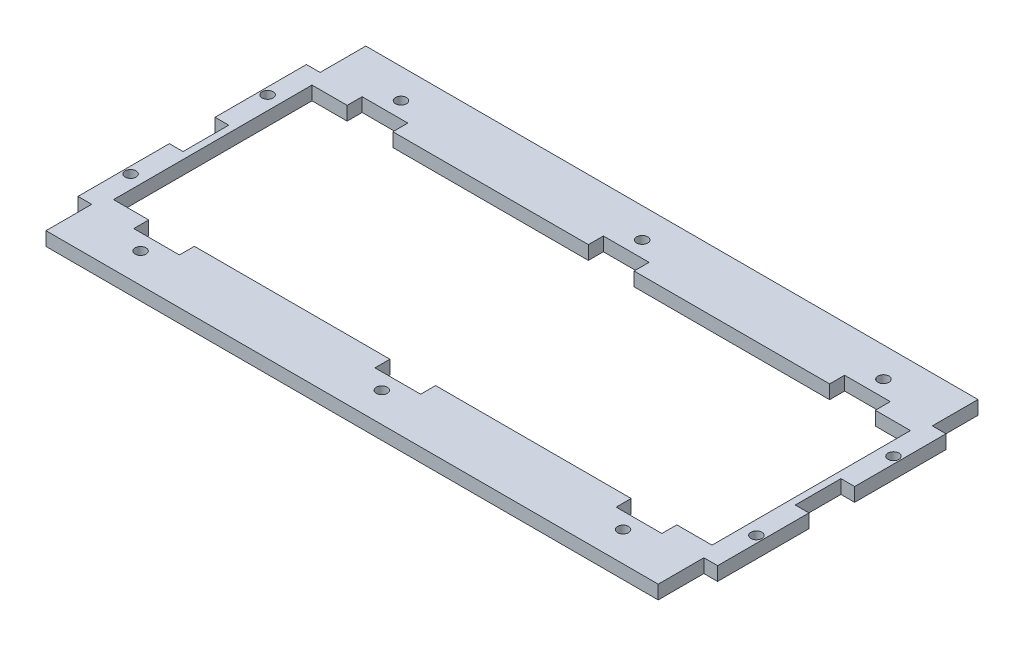
from build123d import *

# Parameters (mm, degrees)
SKETCH1_R           = 1.524
BOSS_EXTRUDE1_DEPTH = 3.81


with BuildPart() as part:
    # Sketch1 → Boss-Extrude1 (new body)
    with BuildSketch(Plane(origin=(0, 0, 0), x_dir=(1, 0, 0), z_dir=(0, 1, 0))):
        Polygon((-85.09, -44.45), (85.09, -44.45), (85.09, -31.75), (88.9, -31.75), (88.9, -6.35), (85.09, -6.35), (85.09, 6.35), (88.9, 6.35), (88.9, 31.75), (85.09, 31.75), (85.09, 44.45), (-85.09, 44.45), (-85.09, 31.75), (-88.9, 31.75), (-88.9, 6.35), (-85.09, 6.35), (-85.09, -6.35), (-88.9, -6.35), (-88.9, -31.75), (-85.09, -31.75), align=None)
        with Locations((86.995, 19.05)):
            Circle(SKETCH1_R, mode=Mode.SUBTRACT)
        with Locations((-86.995, 19.05)):
            Circle(SKETCH1_R, mode=Mode.SUBTRACT)
        with Locations((-86.995, -19.05)):
            Circle(SKETCH1_R, mode=Mode.SUBTRACT)
        with Locations((86.995, -19.05)):
            Circle(SKETCH1_R, mode=Mode.SUBTRACT)
        with Locations((-67.056, -36.195)):
            Circle(SKETCH1_R, mode=Mode.SUBTRACT)
        with Locations((0, -36.195)):
            Circle(SKETCH1_R, mode=Mode.SUBTRACT)
        with Locations((67.056, -36.195)):
            Circle(SKETCH1_R, mode=Mode.SUBTRACT)
        with Locations((67.056, 36.195)):
            Circle(SKETCH1_R, mode=Mode.SUBTRACT)
        with Locations((-67.056, 36.195)):
            Circle(SKETCH1_R, mode=Mode.SUBTRACT)
        with Locations((0, 36.195)):
            Circle(SKETCH1_R, mode=Mode.SUBTRACT)
        Polygon((-83.185, -27.5844), (-73.406, -27.5844), (-73.406, -31.75), (-60.706, -31.75), (-60.706, -27.5844), (-6.35, -27.5844), (-6.35, -31.75), (6.35, -31.75), (6.35, -27.5844), (60.706, -27.5844), (60.706, -31.75), (73.406, -31.75), (73.406, -27.5844), (83.185, -27.5844), (83.185, 27.5844), (73.406, 27.5844), (73.406, 31.75), (60.706, 31.75), (60.706, 27.5844), (6.35, 27.5844), (6.35, 31.75), (-6.35, 31.75), (-6.35, 27.5844), (-60.706, 27.5844), (-60.706, 31.75), (-73.406, 31.75), (-73.406, 27.5844), (-83.185, 27.5844), align=None, mode=Mode.SUBTRACT)
    extrude(amount=BOSS_EXTRUDE1_DEPTH)


solid = part.part
